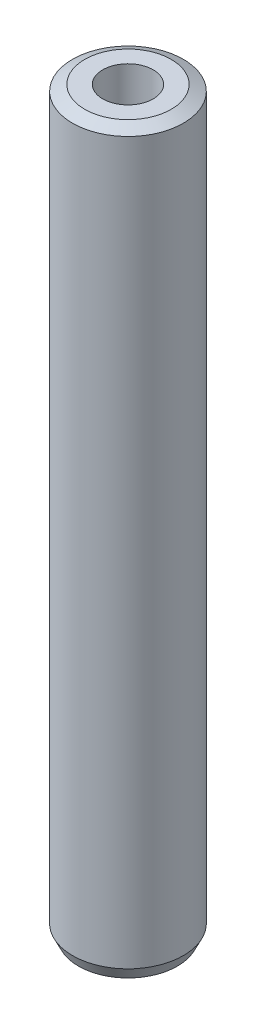
from build123d import *
from OCP.BRepFilletAPI import BRepFilletAPI_MakeChamfer

# Parameters (mm, degrees)
SKETCH1_R           = 45
BOSS_EXTRUDE1_DEPTH = 600
SKETCH2_R           = 20.491697071
CUT_EXTRUDE1_DEPTH  = 604.365560834
CHAMFER1_SIZE       = 4.857065007
CHAMFER1_SIZE2      = 9.873318094


with BuildPart() as part:
    # Sketch1 → Boss-Extrude1 (new body)
    with BuildSketch(Plane(origin=(0, 0, 0), x_dir=(1, 0, 0), z_dir=(0, 1, 0))):
        Circle(SKETCH1_R)
    extrude(amount=BOSS_EXTRUDE1_DEPTH)

    # Sketch2 → Cut-Extrude1 (cut, through all)
    with BuildSketch(Plane(origin=(0, 0, 0), x_dir=(1, 0, 0), z_dir=(0, 1, 0))):
        Circle(SKETCH2_R)
    extrude(amount=CUT_EXTRUDE1_DEPTH, mode=Mode.SUBTRACT)

    # Chamfer1: one chamfer whose edges measure the first distance from different faces: ONE call of the kernel's chamfer builder (chamfer() names one face for all edges)
    chamfer1_edges_1 = [part.edges().sort_by_distance(p)[0] for p in [
        (-45, 600, 0),
    ]]
    chamfer1_side_1 = [part.faces().sort_by_distance(p)[0] for p in [
        (-45, 300, 0),
    ]]
    chamfer1_edges_2 = [part.edges().sort_by_distance(p)[0] for p in [
        (-45, 0, 0),
    ]]
    chamfer1_side_2 = [part.faces().sort_by_distance(p)[0] for p in [
        (-43.727207794, 0, 0),
    ]]
    chamfer1 = BRepFilletAPI_MakeChamfer(part.part.solid().wrapped)
    for e in chamfer1_edges_1:
        chamfer1.Add(CHAMFER1_SIZE, CHAMFER1_SIZE2, e.wrapped, chamfer1_side_1[0].wrapped)  # the first distance lies on this face
    for e in chamfer1_edges_2:
        chamfer1.Add(CHAMFER1_SIZE, CHAMFER1_SIZE2, e.wrapped, chamfer1_side_2[0].wrapped)  # the first distance lies on this face
    add(Compound.cast(chamfer1.Shape()), mode=Mode.REPLACE)


solid = part.part
